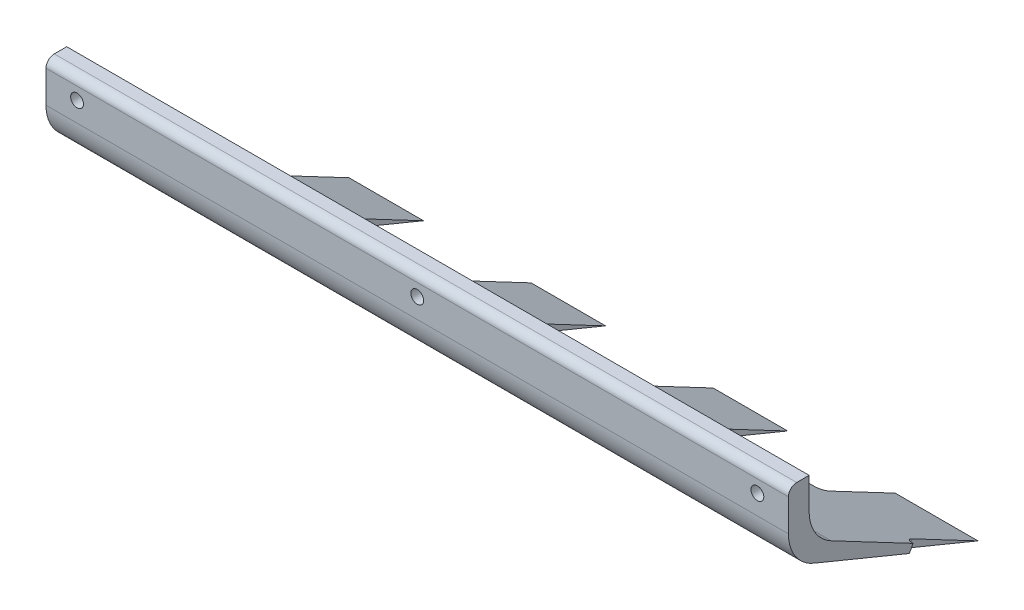
from build123d import *

# Parameters (mm, degrees)
BOSS_EXTRUDE1_DEPTH = 179.4
FILLET3_R           = 10
CUT_EXTRUDE3_REACH  = 193.526
SKETCH4_R           = 1.55
CUT_EXTRUDE5_REACH  = 192.528
SKETCH7_W           = 26
SKETCH7_H           = 20
SKETCH7_W_2         = 25.4
SKETCH7_W_3         = 2
FILLET6_R           = 2
FILLET7_R           = 2


with BuildPart() as part:
    # Sketch1 → Boss-Extrude1 (new body)
    with BuildSketch(Plane(origin=(0, 0, 0), x_dir=(0, 0, -1), z_dir=(1, 0, 0))):
        Polygon((-2.5, -15.488635846), (-2.5, -31.932011519), (45.315389352, -51.619548933), (2.5, -29.045260173), (2.5, -15.488635846), align=None)
    extrude(amount=BOSS_EXTRUDE1_DEPTH)

    # Fillet3
    fillet3_edges = [part.edges().sort_by_distance(p)[0] for p in [
        (89.7, -29.045260173, -2.5),
        (89.7, -31.932011519, 2.5),
    ]]
    fillet(fillet3_edges, radius=FILLET3_R)

    # Sketch4 → Cut-Extrude3 (cut, up to next)
    with BuildSketch(Plane(origin=(0, 0, -2.5), x_dir=(-1, 0, 0), z_dir=(0, 0, -1)), mode=Mode.PRIVATE) as cut_extrude3_sk1:
        with Locations(Location((-171.9, -20.488635846, 0), (0, 0, 90))):
            Circle(SKETCH4_R)
    cut_extrude3_tool1 = extrude(cut_extrude3_sk1.sketch, amount=-CUT_EXTRUDE3_REACH, mode=Mode.PRIVATE) & part.part
    # Sketch4 → Cut-Extrude3 (cut, up to next)
    with BuildSketch(Plane(origin=(0, 0, -2.5), x_dir=(-1, 0, 0), z_dir=(0, 0, -1)), mode=Mode.PRIVATE) as cut_extrude3_sk2:
        with Locations(Location((-7.5, -20.488635846, 0), (0, 0, 90))):
            Circle(SKETCH4_R)
    cut_extrude3_tool2 = extrude(cut_extrude3_sk2.sketch, amount=-CUT_EXTRUDE3_REACH, mode=Mode.PRIVATE) & part.part
    # Sketch4 → Cut-Extrude3 (cut, up to next)
    with BuildSketch(Plane(origin=(0, 0, -2.5), x_dir=(-1, 0, 0), z_dir=(0, 0, -1)), mode=Mode.PRIVATE) as cut_extrude3_sk3:
        with Locations(Location((-89.7, -20.488635846, 0), (0, 0, 90))):
            Circle(SKETCH4_R)
    cut_extrude3_tool3 = extrude(cut_extrude3_sk3.sketch, amount=-CUT_EXTRUDE3_REACH, mode=Mode.PRIVATE) & part.part
    add(cut_extrude3_tool1.solids().sort_by_distance((171.9, -20.488636, -2.5))[0], mode=Mode.SUBTRACT)
    add(cut_extrude3_tool2.solids().sort_by_distance((7.5, -20.488636, -2.5))[0], mode=Mode.SUBTRACT)
    add(cut_extrude3_tool3.solids().sort_by_distance((89.7, -20.488636, -2.5))[0], mode=Mode.SUBTRACT)

    # Sketch7 → Cut-Extrude5 (cut, up to next)
    with BuildSketch(Plane(origin=(0, -21.695908288, 11.439104164), x_dir=(1, 0, 0), z_dir=(0, 0.8845784624906722, -0.466391406114691)), mode=Mode.PRIVATE) as cut_extrude5_sk1:
        with Locations((144.4, 54.15993145)):
            Rectangle(SKETCH7_W, SKETCH7_H)
    cut_extrude5_tool1 = extrude(cut_extrude5_sk1.sketch, amount=-CUT_EXTRUDE5_REACH, mode=Mode.PRIVATE) & part.part
    # Sketch7 → Cut-Extrude5 (cut, up to next)
    with BuildSketch(Plane(origin=(0, -21.695908288, 11.439104164), x_dir=(1, 0, 0), z_dir=(0, 0.8845784624906722, -0.466391406114691)), mode=Mode.PRIVATE) as cut_extrude5_sk2:
        with Locations((100.4, 54.15993145)):
            Rectangle(SKETCH7_W, SKETCH7_H)
    cut_extrude5_tool2 = extrude(cut_extrude5_sk2.sketch, amount=-CUT_EXTRUDE5_REACH, mode=Mode.PRIVATE) & part.part
    # Sketch7 → Cut-Extrude5 (cut, up to next)
    with BuildSketch(Plane(origin=(0, -21.695908288, 11.439104164), x_dir=(1, 0, 0), z_dir=(0, 0.8845784624906722, -0.466391406114691)), mode=Mode.PRIVATE) as cut_extrude5_sk3:
        with Locations((56.4, 54.15993145)):
            Rectangle(SKETCH7_W, SKETCH7_H)
    cut_extrude5_tool3 = extrude(cut_extrude5_sk3.sketch, amount=-CUT_EXTRUDE5_REACH, mode=Mode.PRIVATE) & part.part
    # Sketch7 → Cut-Extrude5 (cut, up to next)
    with BuildSketch(Plane(origin=(0, -21.695908288, 11.439104164), x_dir=(1, 0, 0), z_dir=(0, 0.8845784624906722, -0.466391406114691)), mode=Mode.PRIVATE) as cut_extrude5_sk4:
        with Locations((12.7, 54.15993145)):
            Rectangle(SKETCH7_W_2, SKETCH7_H)
    cut_extrude5_tool4 = extrude(cut_extrude5_sk4.sketch, amount=-CUT_EXTRUDE5_REACH, mode=Mode.PRIVATE) & part.part
    # Sketch7 → Cut-Extrude5 (cut, up to next)
    with BuildSketch(Plane(origin=(0, -21.695908288, 11.439104164), x_dir=(1, 0, 0), z_dir=(0, 0.8845784624906722, -0.466391406114691)), mode=Mode.PRIVATE) as cut_extrude5_sk5:
        with Locations((178.4, 54.15993145)):
            Rectangle(SKETCH7_W_3, SKETCH7_H)
    cut_extrude5_tool5 = extrude(cut_extrude5_sk5.sketch, amount=-CUT_EXTRUDE5_REACH, mode=Mode.PRIVATE) & part.part
    add(cut_extrude5_tool1.solids().sort_by_distance((144.4, -46.955635, -36.469605))[0], mode=Mode.SUBTRACT)
    add(cut_extrude5_tool2.solids().sort_by_distance((100.4, -46.955635, -36.469605))[0], mode=Mode.SUBTRACT)
    add(cut_extrude5_tool3.solids().sort_by_distance((56.4, -46.955635, -36.469605))[0], mode=Mode.SUBTRACT)
    add(cut_extrude5_tool4.solids().sort_by_distance((12.7, -46.955635, -36.469605))[0], mode=Mode.SUBTRACT)
    add(cut_extrude5_tool5.solids().sort_by_distance((178.4, -46.955635, -36.469605))[0], mode=Mode.SUBTRACT)

    # Fillet6
    fillet6_edges = [part.edges().sort_by_distance(p)[0] for p in [
        (25.4, -43.131220066, -27.181196576),
        (69.4, -43.131220066, -27.181196576),
        (43.4, -43.131220066, -27.181196576),
        (113.4, -43.131220066, -27.181196576),
        (87.4, -43.131220066, -27.181196576),
        (177.4, -43.131220066, -27.181196576),
        (157.4, -43.131220066, -27.181196576),
        (131.4, -43.131220066, -27.181196576),
    ]]
    fillet(fillet6_edges, radius=FILLET6_R - 0.0001)  # a hair under: the kernel refuses the full size

    # Fillet7
    fillet7_edges = [part.edges().sort_by_distance(p)[0] for p in [
        (89.7, -15.488635846, 2.5),
    ]]
    fillet(fillet7_edges, radius=FILLET7_R)


solid = part.part
